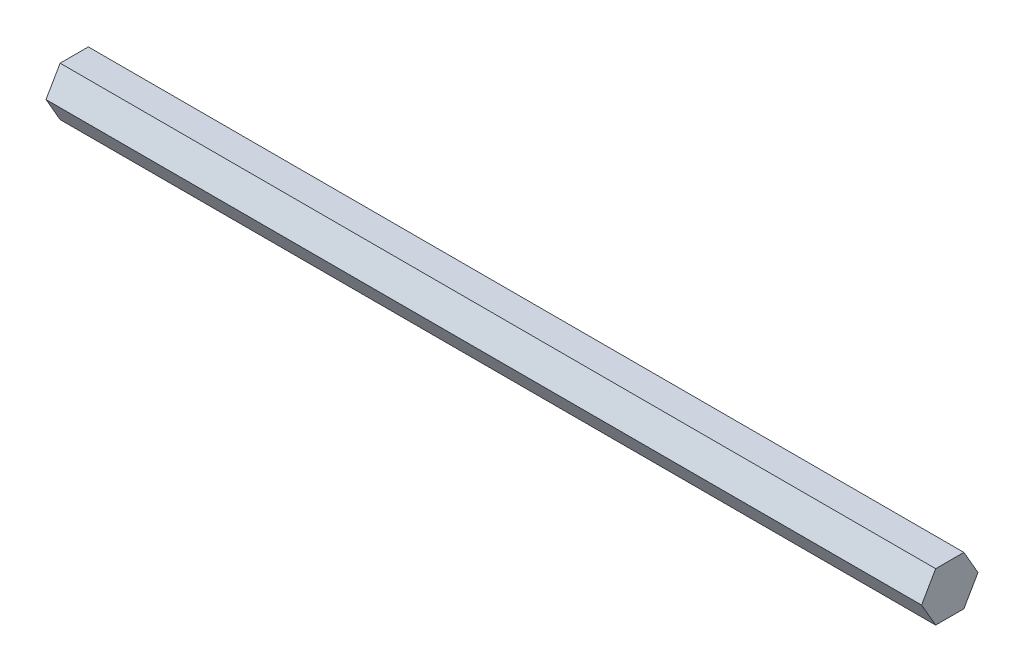
from build123d import *

# Parameters (mm, degrees)
BOSS_EXTRUDE1_DEPTH = 227.5332


with BuildPart() as part:
    # Sketch1 → Boss-Extrude1 (new body)
    with BuildSketch(Plane(origin=(0, 0, 0), x_dir=(0, 0, -1), z_dir=(1, 0, 0))):
        Polygon((3.666174209, 6.35), (-3.666174209, 6.35), (-7.332348419, 0), (-3.666174209, -6.35), (3.666174209, -6.35), (7.332348419, 0), align=None)
    extrude(amount=BOSS_EXTRUDE1_DEPTH)


solid = part.part
